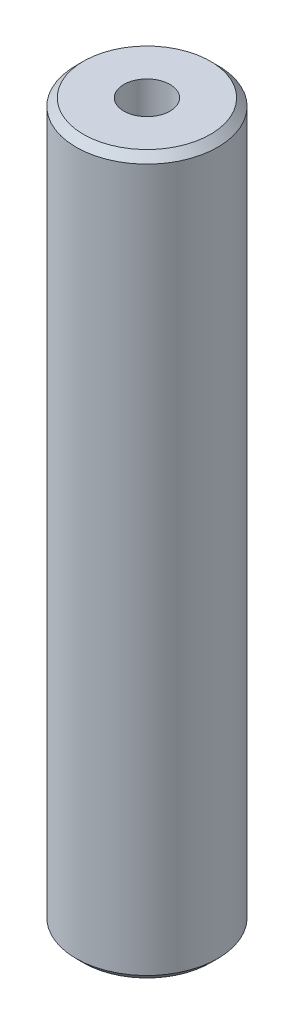
from build123d import *

# Parameters (mm, degrees)
SKETCH1_R           = 42.5
BOSS_EXTRUDE1_DEPTH = 430.48754946
SKETCH2_R           = 13.871127821
CUT_EXTRUDE1_DEPTH  = 435.663122705
CHAMFER1_SIZE       = 4.438427614


with BuildPart() as part:
    # Sketch1 → Boss-Extrude1 (new body)
    with BuildSketch(Plane(origin=(0, 0, 0), x_dir=(1, 0, 0), z_dir=(0, 1, 0))):
        Circle(SKETCH1_R)
    extrude(amount=BOSS_EXTRUDE1_DEPTH)

    # Sketch2 → Cut-Extrude1 (cut, through all)
    with BuildSketch(Plane(origin=(0, 0, 0), x_dir=(1, 0, 0), z_dir=(0, 1, 0))):
        Circle(SKETCH2_R)
    extrude(amount=CUT_EXTRUDE1_DEPTH, mode=Mode.SUBTRACT)

    # Chamfer1
    chamfer1_edges = [part.edges().sort_by_distance(p)[0] for p in [
        (-42.5, 430.48754946, 0),
        (-42.5, 0, 0),
    ]]
    chamfer(chamfer1_edges, length=CHAMFER1_SIZE)


solid = part.part
